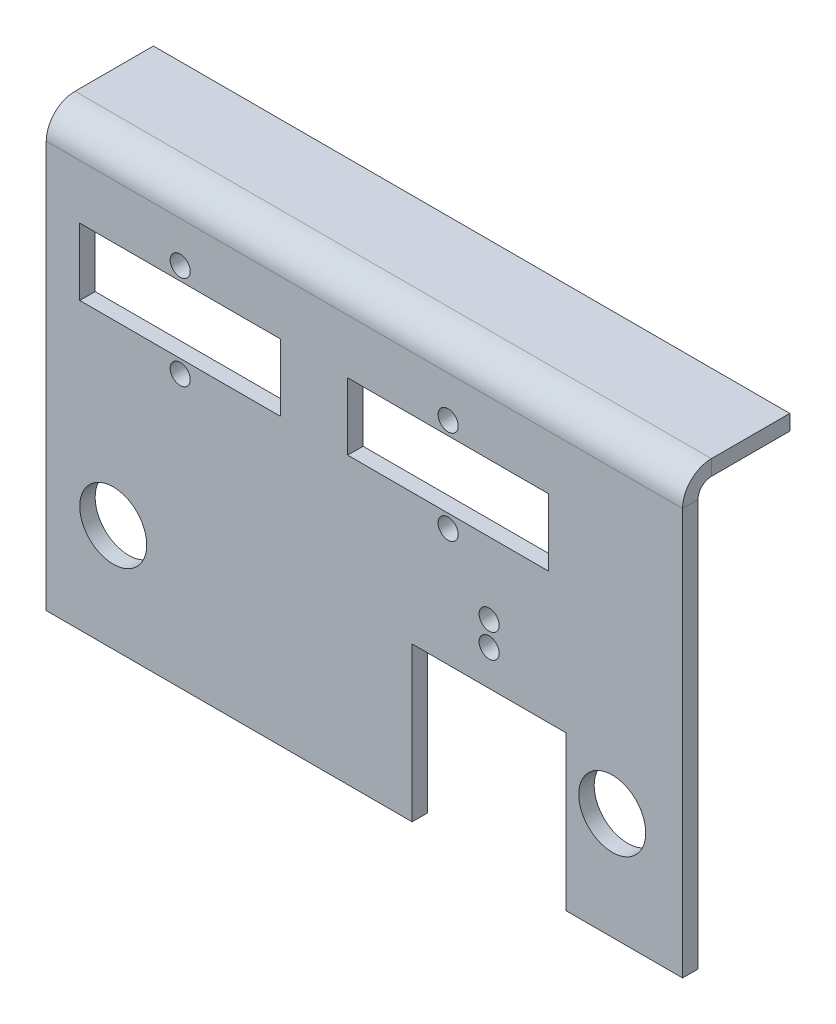
from build123d import *

# Parameters (mm, degrees)
SKETCH1_W                    = 95
SKETCH1_H                    = 65
BASE_FLANGE1_DEPTH           = 2.3
EDGE_FLANGE1_STRIP_W         = 13.2
EDGE_FLANGE1_STRIP_H         = 2.3
EDGE_FLANGE1_STRIP_CUT_DEPTH = 95
EDGE_FLANGE1_DEPTH           = 95
CUT_EXTRUDE1_REACH           = 118.215
SKETCH9_R                    = 1.5
SKETCH9_W                    = 23
SKETCH9_H                    = 23
CUT_EXTRUDE3_REACH           = 117.921
SKETCH10_R                   = 1.5
SKETCH10_W                   = 30
SKETCH10_H                   = 10
CUT_EXTRUDE4_REACH           = 117.921
SKETCH11_R                   = 5


# Sheet-metal steps are written as plain solids
with BuildPart() as part:
    # Sketch1 → Base-Flange1 (new body)
    with BuildSketch(Plane.XY):
        with Locations((47.5, 32.5)):
            Rectangle(SKETCH1_W, SKETCH1_H)
    extrude(amount=-BASE_FLANGE1_DEPTH)

    # Edge-Flange1 strip (across the edge) → Edge-Flange1 strip cut (cut)
    with BuildSketch(Plane(origin=(0, 65, -2.3), x_dir=(0, -1, 0), z_dir=(1, 0, 0))):
        with Locations((-2.3, -1.15)):
            Rectangle(EDGE_FLANGE1_STRIP_W, EDGE_FLANGE1_STRIP_H)
    extrude(amount=EDGE_FLANGE1_STRIP_CUT_DEPTH, mode=Mode.SUBTRACT)

    # Edge-Flange1 section (across the edge) → Edge-Flange1 (add)
    with BuildSketch(Plane(origin=(0, 65, -2.3), x_dir=(0, -1, 0), z_dir=(1, 0, 0))):
        with BuildLine():
            Line((0, 2), (0, 13.7))
            Line((0, 13.7), (2.3, 13.7))
            Line((2.3, 13.7), (2.3, 2))
            ThreePointArc((2.3, 2), (2.885786438, 0.585786438), (4.3, 0))
            Line((4.3, 0), (4.3, -2.3))
            ThreePointArc((4.3, -2.3), (1.259440841, -1.040559159), (0, 2))
        make_face()
    extrude(amount=EDGE_FLANGE1_DEPTH)

    # Sketch9 → Cut-Extrude1 (cut, up to next)
    with BuildSketch(Plane.XY, mode=Mode.PRIVATE) as cut_extrude1_sk1:
        with Locations((66.12, 28.3)):
            Circle(SKETCH9_R)
    cut_extrude1_tool1 = extrude(cut_extrude1_sk1.sketch, amount=-CUT_EXTRUDE1_REACH, mode=Mode.PRIVATE) & part.part
    # Sketch9 → Cut-Extrude1 (cut, up to next)
    with BuildSketch(Plane.XY, mode=Mode.PRIVATE) as cut_extrude1_sk2:
        with Locations((66.12, 31.9)):
            Circle(SKETCH9_R)
    cut_extrude1_tool2 = extrude(cut_extrude1_sk2.sketch, amount=-CUT_EXTRUDE1_REACH, mode=Mode.PRIVATE) & part.part
    # Sketch9 → Cut-Extrude1 (cut, up to next)
    with BuildSketch(Plane.XY, mode=Mode.PRIVATE) as cut_extrude1_sk3:
        with Locations((66.12, 11.5)):
            Rectangle(SKETCH9_W, SKETCH9_H)
    cut_extrude1_tool3 = extrude(cut_extrude1_sk3.sketch, amount=-CUT_EXTRUDE1_REACH, mode=Mode.PRIVATE) & part.part
    add(cut_extrude1_tool1.solids().sort_by_distance((66.12, 28.3, 0))[0], mode=Mode.SUBTRACT)
    add(cut_extrude1_tool2.solids().sort_by_distance((66.12, 31.9, 0))[0], mode=Mode.SUBTRACT)
    add(cut_extrude1_tool3.solids().sort_by_distance((66.12, 11.5, 0))[0], mode=Mode.SUBTRACT)

    # Sketch10 → Cut-Extrude3 (cut, up to next)
    with BuildSketch(Plane(origin=(0, 0, -2.3), x_dir=(-1, 0, 0), z_dir=(0, 0, -1)), mode=Mode.PRIVATE) as cut_extrude3_sk1:
        with Locations((-60, 54.6)):
            Circle(SKETCH10_R)
    cut_extrude3_tool1 = extrude(cut_extrude3_sk1.sketch, amount=-CUT_EXTRUDE3_REACH, mode=Mode.PRIVATE) & part.part
    # Sketch10 → Cut-Extrude3 (cut, up to next)
    with BuildSketch(Plane(origin=(0, 0, -2.3), x_dir=(-1, 0, 0), z_dir=(0, 0, -1)), mode=Mode.PRIVATE) as cut_extrude3_sk2:
        with Locations((-60, 40.6)):
            Circle(SKETCH10_R)
    cut_extrude3_tool2 = extrude(cut_extrude3_sk2.sketch, amount=-CUT_EXTRUDE3_REACH, mode=Mode.PRIVATE) & part.part
    # Sketch10 → Cut-Extrude3 (cut, up to next)
    with BuildSketch(Plane(origin=(0, 0, -2.3), x_dir=(-1, 0, 0), z_dir=(0, 0, -1)), mode=Mode.PRIVATE) as cut_extrude3_sk3:
        with Locations((-20, 54.6)):
            Circle(SKETCH10_R)
    cut_extrude3_tool3 = extrude(cut_extrude3_sk3.sketch, amount=-CUT_EXTRUDE3_REACH, mode=Mode.PRIVATE) & part.part
    # Sketch10 → Cut-Extrude3 (cut, up to next)
    with BuildSketch(Plane(origin=(0, 0, -2.3), x_dir=(-1, 0, 0), z_dir=(0, 0, -1)), mode=Mode.PRIVATE) as cut_extrude3_sk4:
        with Locations((-20, 40.6)):
            Circle(SKETCH10_R)
    cut_extrude3_tool4 = extrude(cut_extrude3_sk4.sketch, amount=-CUT_EXTRUDE3_REACH, mode=Mode.PRIVATE) & part.part
    # Sketch10 → Cut-Extrude3 (cut, up to next)
    with BuildSketch(Plane(origin=(0, 0, -2.3), x_dir=(-1, 0, 0), z_dir=(0, 0, -1)), mode=Mode.PRIVATE) as cut_extrude3_sk5:
        with Locations((-20, 47.6)):
            Rectangle(SKETCH10_W, SKETCH10_H)
    cut_extrude3_tool5 = extrude(cut_extrude3_sk5.sketch, amount=-CUT_EXTRUDE3_REACH, mode=Mode.PRIVATE) & part.part
    # Sketch10 → Cut-Extrude3 (cut, up to next)
    with BuildSketch(Plane(origin=(0, 0, -2.3), x_dir=(-1, 0, 0), z_dir=(0, 0, -1)), mode=Mode.PRIVATE) as cut_extrude3_sk6:
        with Locations((-60, 47.6)):
            Rectangle(SKETCH10_W, SKETCH10_H)
    cut_extrude3_tool6 = extrude(cut_extrude3_sk6.sketch, amount=-CUT_EXTRUDE3_REACH, mode=Mode.PRIVATE) & part.part
    add(cut_extrude3_tool1.solids().sort_by_distance((60, 54.6, -2.3))[0], mode=Mode.SUBTRACT)
    add(cut_extrude3_tool2.solids().sort_by_distance((60, 40.6, -2.3))[0], mode=Mode.SUBTRACT)
    add(cut_extrude3_tool3.solids().sort_by_distance((20, 54.6, -2.3))[0], mode=Mode.SUBTRACT)
    add(cut_extrude3_tool4.solids().sort_by_distance((20, 40.6, -2.3))[0], mode=Mode.SUBTRACT)
    add(cut_extrude3_tool5.solids().sort_by_distance((20, 47.6, -2.3))[0], mode=Mode.SUBTRACT)
    add(cut_extrude3_tool6.solids().sort_by_distance((60, 47.6, -2.3))[0], mode=Mode.SUBTRACT)

    # Sketch11 → Cut-Extrude4 (cut, up to next)
    with BuildSketch(Plane(origin=(0, 0, -2.3), x_dir=(-1, 0, 0), z_dir=(0, 0, -1)), mode=Mode.PRIVATE) as cut_extrude4_sk1:
        with Locations((-10, 16)):
            Circle(SKETCH11_R)
    cut_extrude4_tool1 = extrude(cut_extrude4_sk1.sketch, amount=-CUT_EXTRUDE4_REACH, mode=Mode.PRIVATE) & part.part
    # Sketch11 → Cut-Extrude4 (cut, up to next)
    with BuildSketch(Plane(origin=(0, 0, -2.3), x_dir=(-1, 0, 0), z_dir=(0, 0, -1)), mode=Mode.PRIVATE) as cut_extrude4_sk2:
        with Locations((-84.5, 16)):
            Circle(SKETCH11_R)
    cut_extrude4_tool2 = extrude(cut_extrude4_sk2.sketch, amount=-CUT_EXTRUDE4_REACH, mode=Mode.PRIVATE) & part.part
    add(cut_extrude4_tool1.solids().sort_by_distance((10, 16, -2.3))[0], mode=Mode.SUBTRACT)
    add(cut_extrude4_tool2.solids().sort_by_distance((84.5, 16, -2.3))[0], mode=Mode.SUBTRACT)


solid = part.part
